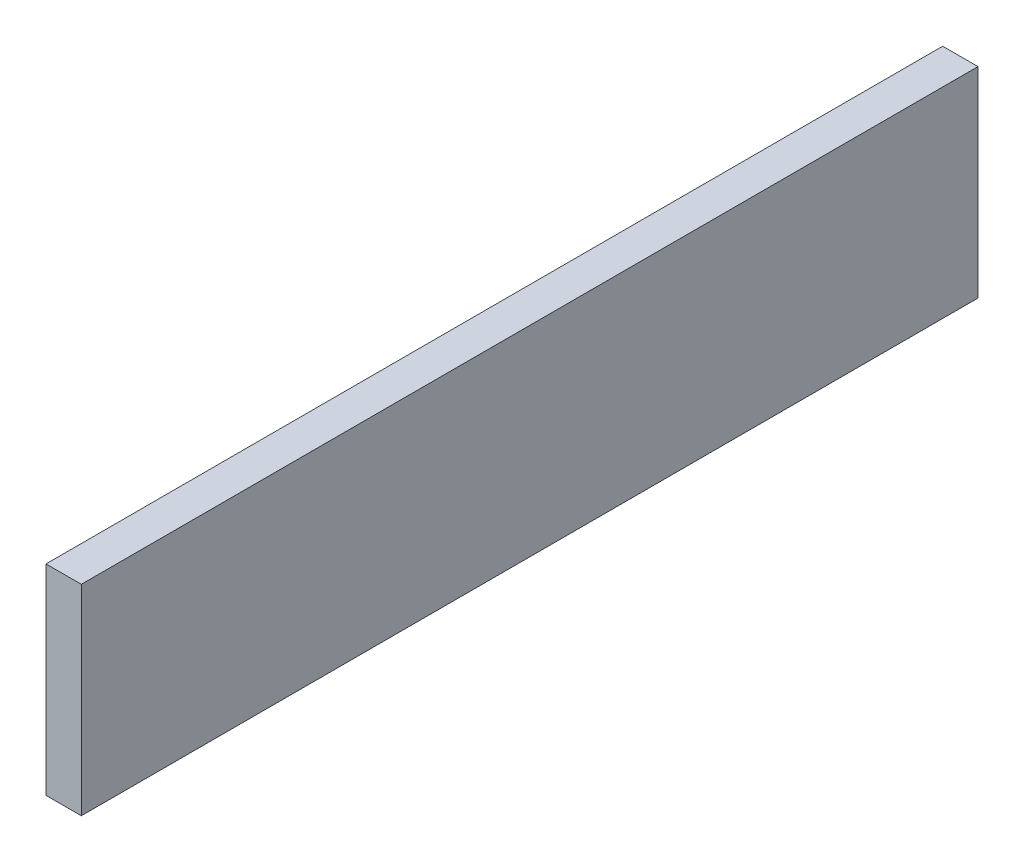
from build123d import *

# Parameters (mm, degrees)
SKETCH5_W                = 117.163543562
SKETCH5_H                = 56.789414834
BOSS_EXTRUDE1_DEPTH      = 254
CONVERT_SOLID1_START     = -59.277562159
CONVERT_SOLID1_OUTLINE_W = 56.789414834
CONVERT_SOLID1_OUTLINE_H = 254
CONVERT_SOLID1_DEPTH     = 107.163543562


# Read off the part's stored shape, not the designer's step: Convert-Solid1
with BuildPart() as part:
    # Sketch5 → Boss-Extrude1 (new body)
    with BuildSketch(Plane.XY):
        with Locations((-0.695790378, 5.471405416)):
            Rectangle(SKETCH5_W, SKETCH5_H)
    extrude(amount=BOSS_EXTRUDE1_DEPTH)

    # Convert-Solid1 outline → Convert-Solid1 (cut)
    with BuildSketch(Plane.YZ.offset(CONVERT_SOLID1_START)):
        with Locations((5.471405416, 127)):
            Rectangle(CONVERT_SOLID1_OUTLINE_W, CONVERT_SOLID1_OUTLINE_H)
    extrude(amount=CONVERT_SOLID1_DEPTH, mode=Mode.SUBTRACT)


solid = part.part
